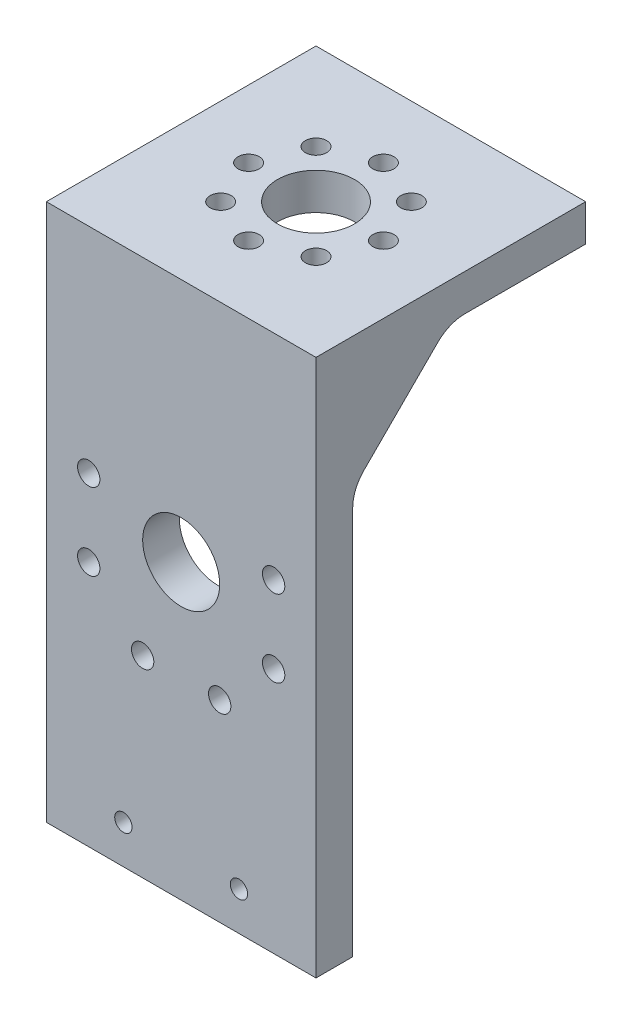
from build123d import *

# Parameters (mm, degrees)
SKETCH1_W                      = 70
SKETCH1_H                      = 70
BOSS_EXTRUDE1_DEPTH            = 9.525
CBORE_FOR_M5_SBHCS1_AT_2_COUNT = 2
CBORE_FOR_M5_SBHCS1_AT_2_PITCH = 13.393920133
CBORE_FOR_M5_SBHCS1_AT_3_COUNT = 2
CBORE_FOR_M5_SBHCS1_AT_3_PITCH = 24.748737342
CBORE_FOR_M5_SBHCS1_AT_4_COUNT = 2
CBORE_FOR_M5_SBHCS1_AT_4_PITCH = 32.335783638
CBORE_FOR_M5_SBHCS1_AT_5_COUNT = 2
CBORE_FOR_M5_SBHCS1_AT_5_PITCH = 35
CBORE_FOR_M5_SBHCS1_AT_6_COUNT = 2
CBORE_FOR_M5_SBHCS1_AT_6_PITCH = 32.335783638
CBORE_FOR_M5_SBHCS1_AT_7_COUNT = 2
CBORE_FOR_M5_SBHCS1_AT_7_PITCH = 24.748737342
CBORE_FOR_M5_SBHCS1_AT_8_COUNT = 2
CBORE_FOR_M5_SBHCS1_AT_8_PITCH = 13.393920133
SKETCH5_R                      = 10
CUT_EXTRUDE1_DEPTH             = 51.405611047
SKETCH6_W                      = 70
SKETCH6_H                      = 130
BOSS_EXTRUDE2_DEPTH            = 9.525
CBORE_FOR_M5_SHCS1_D           = 5.8
CBORE_FOR_M5_SHCS1_CBORE_D     = 10
CBORE_FOR_M5_SHCS1_CBORE_DEPTH = 5
SKETCH7_R                      = 10
CUT_EXTRUDE3_DEPTH             = 9.525
BOSS_EXTRUDE3_DEPTH            = 8
FILLET1_R                      = 10
FILLET1_OF_MIRROR1_R           = 10
M4_CLEARANCE_HOLE1_D           = 4.5


with BuildPart() as part:
    # Sketch1 → Boss-Extrude1 (new body)
    with BuildSketch(Plane(origin=(0, 0, 0), x_dir=(1, 0, 0), z_dir=(0, 1, 0))):
        Rectangle(SKETCH1_W, SKETCH1_H)
    extrude(amount=BOSS_EXTRUDE1_DEPTH)

    # Sketch4 → CBORE for M5 SBHCS1 (revolve, cut)
    with BuildSketch(Plane(origin=(17.5, 0, 0), x_dir=(0, 0, -1), z_dir=(1, 0, 0))):
        Polygon((0, 0), (0, 9.525), (2.75, 9.525), (2.75, 2.75), (5.25, 2.75), (5.25, 0.025), (5.275, 0), align=None)
    cbore_for_m5_sbhcs1 = revolve(axis=Axis((17.5, -6.35, 0), (0, 1, 0)), mode=Mode.SUBTRACT)

    # CBORE for M5 SBHCS1 at 2: CBORE for M5 SBHCS1 ×2
    with Locations(*[Vector(-0.3826834323650897, 0, -0.9238795325112868) * (i * CBORE_FOR_M5_SBHCS1_AT_2_PITCH) for i in range(1, CBORE_FOR_M5_SBHCS1_AT_2_COUNT)]):
        add(cbore_for_m5_sbhcs1, mode=Mode.SUBTRACT)

    # CBORE for M5 SBHCS1 at 3: CBORE for M5 SBHCS1 ×2
    with Locations(*[Vector(-0.7071067811865476, 0, -0.7071067811865476) * (i * CBORE_FOR_M5_SBHCS1_AT_3_PITCH) for i in range(1, CBORE_FOR_M5_SBHCS1_AT_3_COUNT)]):
        add(cbore_for_m5_sbhcs1, mode=Mode.SUBTRACT)

    # CBORE for M5 SBHCS1 at 4: CBORE for M5 SBHCS1 ×2
    with Locations(*[Vector(-0.9238795325112867, 0, -0.38268343236508984) * (i * CBORE_FOR_M5_SBHCS1_AT_4_PITCH) for i in range(1, CBORE_FOR_M5_SBHCS1_AT_4_COUNT)]):
        add(cbore_for_m5_sbhcs1, mode=Mode.SUBTRACT)

    # CBORE for M5 SBHCS1 at 5: CBORE for M5 SBHCS1 ×2
    with Locations(*[(-i * CBORE_FOR_M5_SBHCS1_AT_5_PITCH, 0, 0) for i in range(1, CBORE_FOR_M5_SBHCS1_AT_5_COUNT)]):
        add(cbore_for_m5_sbhcs1, mode=Mode.SUBTRACT)

    # CBORE for M5 SBHCS1 at 6: CBORE for M5 SBHCS1 ×2
    with Locations(*[Vector(-0.9238795325112868, 0, 0.38268343236508967) * (i * CBORE_FOR_M5_SBHCS1_AT_6_PITCH) for i in range(1, CBORE_FOR_M5_SBHCS1_AT_6_COUNT)]):
        add(cbore_for_m5_sbhcs1, mode=Mode.SUBTRACT)

    # CBORE for M5 SBHCS1 at 7: CBORE for M5 SBHCS1 ×2
    with Locations(*[Vector(-0.7071067811865477, 0, 0.7071067811865475) * (i * CBORE_FOR_M5_SBHCS1_AT_7_PITCH) for i in range(1, CBORE_FOR_M5_SBHCS1_AT_7_COUNT)]):
        add(cbore_for_m5_sbhcs1, mode=Mode.SUBTRACT)

    # CBORE for M5 SBHCS1 at 8: CBORE for M5 SBHCS1 ×2
    with Locations(*[Vector(-0.3826834323650897, 0, 0.9238795325112868) * (i * CBORE_FOR_M5_SBHCS1_AT_8_PITCH) for i in range(1, CBORE_FOR_M5_SBHCS1_AT_8_COUNT)]):
        add(cbore_for_m5_sbhcs1, mode=Mode.SUBTRACT)

    # Sketch5 → Cut-Extrude1 (cut, through all)
    with BuildSketch(Plane.XZ):
        Circle(SKETCH5_R)
    extrude(amount=-CUT_EXTRUDE1_DEPTH, mode=Mode.SUBTRACT)

    # Sketch6 → Boss-Extrude2 (add)
    with BuildSketch(Plane.XY.offset(35)):
        with Locations((0, -65)):
            Rectangle(SKETCH6_W, SKETCH6_H)
    extrude(amount=-BOSS_EXTRUDE2_DEPTH)

    # CBORE for M5 SHCS1 (through all)
    with Locations(Plane(origin=(0, 0, 25.475), x_dir=(-1, 0, 0), z_dir=(0, 0, -1))):
        with Locations((-24, -46), (-24, -66), (-10, -80), (10, -80), (24, -66), (24, -46)):
            CounterBoreHole(CBORE_FOR_M5_SHCS1_D / 2, CBORE_FOR_M5_SHCS1_CBORE_D / 2, CBORE_FOR_M5_SHCS1_CBORE_DEPTH)

    # Sketch7 → Cut-Extrude3 (cut)
    with BuildSketch(Plane(origin=(0, 0, 25.475), x_dir=(-1, 0, 0), z_dir=(0, 0, -1))):
        with Locations((0, -54)):
            Circle(SKETCH7_R)
    extrude(amount=-CUT_EXTRUDE3_DEPTH, mode=Mode.SUBTRACT)

    # Sketch17 → Boss-Extrude3 (add)
    with BuildSketch(Plane.ZY.offset(35)):
        Polygon((25.475, 0), (25.475, -25), (0.475, 0), align=None)
    boss_extrude3 = extrude(amount=-BOSS_EXTRUDE3_DEPTH)

    # Fillet1
    fillet1_edges = [part.edges().sort_by_distance(p)[0] for p in [
        (-31, 0, 0.475),
        (-31, -25, 25.475),
    ]]
    fillet(fillet1_edges, radius=FILLET1_R)

    # Mirror1: Boss-Extrude3 across plane
    add(boss_extrude3.mirror(Plane(origin=(0, 0, 0), x_dir=(0, 0, 1), z_dir=(1, 0, 0))))

    # Fillet1 of Mirror1
    fillet1_of_mirror1_edges = [part.edges().sort_by_distance(p)[0] for p in [
        (31, 0, 0.475),
        (31, -25, 25.475),
    ]]
    fillet(fillet1_of_mirror1_edges, radius=FILLET1_OF_MIRROR1_R)

    # M4 Clearance Hole1 (through all)
    with Locations(Plane.XY.offset(35)):
        with Locations((15, -120), (-15, -120)):
            Hole(M4_CLEARANCE_HOLE1_D / 2)


solid = part.part
